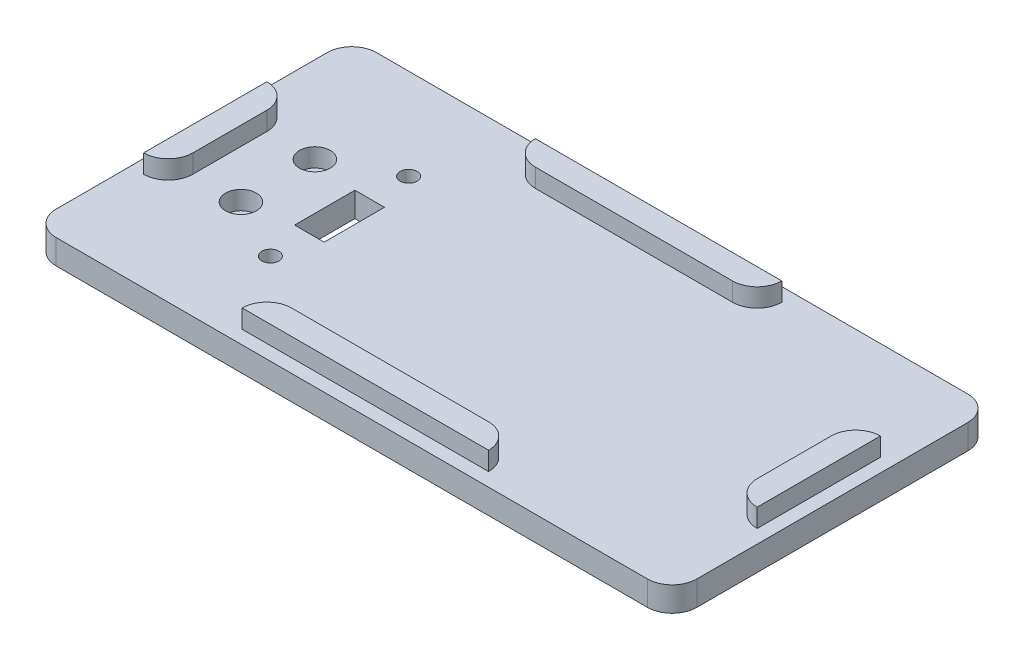
from build123d import *

# Parameters (mm, degrees)
SKETCH1_W           = 121.92
SKETCH1_H           = 66.04
BOSS_EXTRUDE1_DEPTH = 5.08
FILLET1_R           = 5.08
CUT_EXTRUDE2_REACH  = 140.75
SKETCH2_R           = 1.7526
SKETCH2_W           = 6.096
SKETCH2_H           = 12.446
SKETCH3_R           = 3.175
CUT_EXTRUDE3_DEPTH  = 3.81
CUT_EXTRUDE4_REACH  = 140.709
SKETCH4_R           = 1.9812
SKETCH8_W           = 15.24
SKETCH8_H           = 66.04
BOSS_EXTRUDE2_DEPTH = 5.08
FILLET4_R           = 5.08
SKETCH10_W          = 5.08
SKETCH10_H          = 25.4
BOSS_EXTRUDE4_DEPTH = 3.81
SKETCH11_W          = 50.8
SKETCH11_H          = 5.08
BOSS_EXTRUDE5_DEPTH = 3.81
FILLET5_R           = 5.08


with BuildPart() as part:
    # Sketch1 → Boss-Extrude1 (new body)
    with BuildSketch(Plane(origin=(0, 0, 0), x_dir=(1, 0, 0), z_dir=(0, 1, 0))):
        with Locations((60.96, 33.02)):
            Rectangle(SKETCH1_W, SKETCH1_H)
    extrude(amount=BOSS_EXTRUDE1_DEPTH)

    # Fillet1
    fillet1_edges = [part.edges().sort_by_distance(p)[0] for p in [
        (0, 2.54, -66.04),
        (121.92, 2.54, -66.04),
        (121.92, 2.54, 0),
        (0, 2.54, 0),
    ]]
    fillet(fillet1_edges, radius=FILLET1_R)

    # Sketch2 → Cut-Extrude2 (cut, up to next)
    with BuildSketch(Plane(origin=(0, 5.08, 0), x_dir=(1, 0, 0), z_dir=(0, 1, 0)), mode=Mode.PRIVATE) as cut_extrude2_sk1:
        with Locations(Location((30.48, 47.2694, 0), (0, 0, 270))):
            Circle(SKETCH2_R)
    cut_extrude2_tool1 = extrude(cut_extrude2_sk1.sketch, amount=-CUT_EXTRUDE2_REACH, mode=Mode.PRIVATE) & part.part
    # Sketch2 → Cut-Extrude2 (cut, up to next)
    with BuildSketch(Plane(origin=(0, 5.08, 0), x_dir=(1, 0, 0), z_dir=(0, 1, 0)), mode=Mode.PRIVATE) as cut_extrude2_sk2:
        with Locations(Location((30.48, 18.7706, 0), (0, 0, 90))):
            Circle(SKETCH2_R)
    cut_extrude2_tool2 = extrude(cut_extrude2_sk2.sketch, amount=-CUT_EXTRUDE2_REACH, mode=Mode.PRIVATE) & part.part
    # Sketch2 → Cut-Extrude2 (cut, up to next)
    with BuildSketch(Plane(origin=(0, 5.08, 0), x_dir=(1, 0, 0), z_dir=(0, 1, 0)), mode=Mode.PRIVATE) as cut_extrude2_sk3:
        with Locations((30.48, 33.02)):
            Rectangle(SKETCH2_W, SKETCH2_H)
    cut_extrude2_tool3 = extrude(cut_extrude2_sk3.sketch, amount=-CUT_EXTRUDE2_REACH, mode=Mode.PRIVATE) & part.part
    add(cut_extrude2_tool1.solids().sort_by_distance((30.48, 5.08, -47.2694))[0], mode=Mode.SUBTRACT)
    add(cut_extrude2_tool2.solids().sort_by_distance((30.48, 5.08, -18.7706))[0], mode=Mode.SUBTRACT)
    add(cut_extrude2_tool3.solids().sort_by_distance((30.48, 5.08, -33.02))[0], mode=Mode.SUBTRACT)

    # Sketch3 → Cut-Extrude3 (cut)
    with BuildSketch(Plane(origin=(0, 5.08, 0), x_dir=(1, 0, 0), z_dir=(0, 1, 0))):
        with Locations(Location((17.78, 40.64, 0), (0, 0, 270))):
            Circle(SKETCH3_R)
        with Locations(Location((17.78, 25.4, 0), (0, 0, 270))):
            Circle(SKETCH3_R)
    extrude(amount=-CUT_EXTRUDE3_DEPTH, mode=Mode.SUBTRACT)

    # Sketch4 → Cut-Extrude4 (cut, up to next)
    with BuildSketch(Plane(origin=(0, 1.27, 0), x_dir=(1, 0, 0), z_dir=(0, 1, 0)), mode=Mode.PRIVATE) as cut_extrude4_sk1:
        with Locations(Location((17.78, 40.64, 0), (0, 0, 270))):
            Circle(SKETCH4_R)
    cut_extrude4_tool1 = extrude(cut_extrude4_sk1.sketch, amount=-CUT_EXTRUDE4_REACH, mode=Mode.PRIVATE) & part.part
    # Sketch4 → Cut-Extrude4 (cut, up to next)
    with BuildSketch(Plane(origin=(0, 1.27, 0), x_dir=(1, 0, 0), z_dir=(0, 1, 0)), mode=Mode.PRIVATE) as cut_extrude4_sk2:
        with Locations(Location((17.78, 25.4, 0), (0, 0, 270))):
            Circle(SKETCH4_R)
    cut_extrude4_tool2 = extrude(cut_extrude4_sk2.sketch, amount=-CUT_EXTRUDE4_REACH, mode=Mode.PRIVATE) & part.part
    add(cut_extrude4_tool1.solids().sort_by_distance((17.78, 1.27, -40.64))[0], mode=Mode.SUBTRACT)
    add(cut_extrude4_tool2.solids().sort_by_distance((17.78, 1.27, -25.4))[0], mode=Mode.SUBTRACT)

    # Sketch8 → Boss-Extrude2 (add)
    with BuildSketch(Plane.XZ):
        with Locations((124.46, -33.02)):
            Rectangle(SKETCH8_W, SKETCH8_H)
    extrude(amount=-BOSS_EXTRUDE2_DEPTH)

    # Fillet4
    fillet4_edges = [part.edges().sort_by_distance(p)[0] for p in [
        (132.08, 2.54, 0),
        (132.08, 2.54, -66.04),
    ]]
    fillet(fillet4_edges, radius=FILLET4_R)

    # Sketch10 → Boss-Extrude4 (add)
    with BuildSketch(Plane(origin=(0, 5.08, 0), x_dir=(1, 0, 0), z_dir=(0, 1, 0))):
        with Locations((5.334, 33.02)):
            Rectangle(SKETCH10_W, SKETCH10_H)
        with Locations((126.746, 33.02)):
            Rectangle(SKETCH10_W, SKETCH10_H)
    extrude(amount=BOSS_EXTRUDE4_DEPTH)

    # Sketch11 → Boss-Extrude5 (add)
    with BuildSketch(Plane(origin=(0, 5.08, 0), x_dir=(1, 0, 0), z_dir=(0, 1, 0))):
        with Locations((66.04, 60.706)):
            Rectangle(SKETCH11_W, SKETCH11_H)
        with Locations((66.04, 5.334)):
            Rectangle(SKETCH11_W, SKETCH11_H)
    extrude(amount=BOSS_EXTRUDE5_DEPTH)

    # Fillet5
    fillet5_edges = [part.edges().sort_by_distance(p)[0] for p in [
        (40.64, 6.985, -7.874),
        (91.44, 6.985, -7.874),
        (124.206, 6.985, -20.32),
        (124.206, 6.985, -45.72),
        (91.44, 6.985, -58.166),
        (40.64, 6.985, -58.166),
        (7.874, 6.985, -20.32),
        (7.874, 6.985, -45.72),
    ]]
    fillet(fillet5_edges, radius=FILLET5_R - 0.0001)  # a hair under: the kernel refuses the full size


solid = part.part
